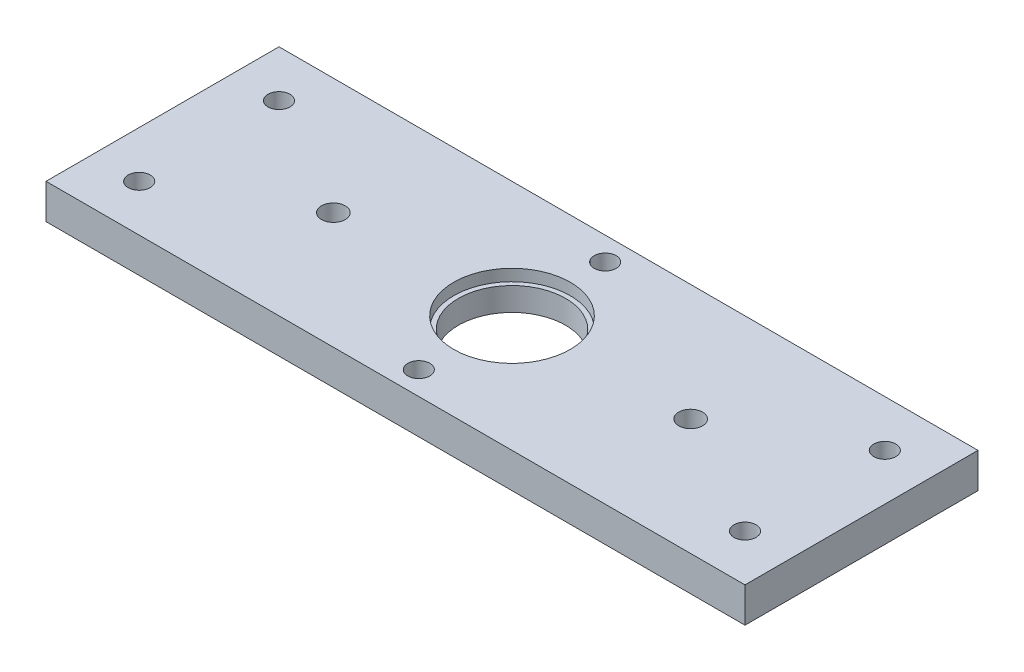
from build123d import *

# Parameters (mm, degrees)
SKETCH1_W                  = 190.5
SKETCH1_H                  = 63.5
BOSS_EXTRUDE1_DEPTH        = 9.525
SKETCH3_R                  = 14.605
CUT_EXTRUDE1_DEPTH         = 101.853114107
F_6_0_6_DIAMETER_HOLE1_D   = 6
F_6_5_6_5_DIAMETER_HOLE3_D = 6.5
SKETCH29_R                 = 15.875
CUT_EXTRUDE5_DEPTH         = 3.175
F_6_0_6_DIAMETER_HOLE3_D   = 6


with BuildPart() as part:
    # Sketch1 → Boss-Extrude1 (new body)
    with BuildSketch(Plane(origin=(0, 0, 0), x_dir=(1, 0, 0), z_dir=(0, 1, 0))):
        Rectangle(SKETCH1_W, SKETCH1_H)
    extrude(amount=BOSS_EXTRUDE1_DEPTH)

    # Sketch3 → Cut-Extrude1 (cut, through all)
    with BuildSketch(Plane(origin=(0, 9.525, 0), x_dir=(1, 0, 0), z_dir=(0, 1, 0))):
        Circle(SKETCH3_R)
    extrude(amount=-CUT_EXTRUDE1_DEPTH, mode=Mode.SUBTRACT)

    # Ø6.0 (6) Diameter Hole1 (through all)
    with Locations(Plane(origin=(0, 0, 0), x_dir=(-1, 0, 0), z_dir=(0, -1, 0))):
        with Locations((0, -25.4), (0, 25.4)):
            Hole(F_6_0_6_DIAMETER_HOLE1_D / 2)

    # Ø6.5 (6.5) Diameter Hole3 (through all)
    with Locations(Plane(origin=(0, 0, 0), x_dir=(-1, 0, 0), z_dir=(0, -1, 0))):
        with Locations((48.683333333, 0), (-48.683333333, 0)):
            Hole(F_6_5_6_5_DIAMETER_HOLE3_D / 2)

    # Sketch29 → Cut-Extrude5 (cut)
    with BuildSketch(Plane(origin=(0, 9.525, 0), x_dir=(1, 0, 0), z_dir=(0, 1, 0))):
        Circle(SKETCH29_R)
    extrude(amount=-CUT_EXTRUDE5_DEPTH, mode=Mode.SUBTRACT)

    # Ø6.0 (6) Diameter Hole3 (through all)
    with Locations(Plane(origin=(0, 9.525, 0), x_dir=(1, 0, 0), z_dir=(0, 1, 0))):
        with Locations((-82.55, 19.05), (-82.55, -19.05), (82.55, -19.05), (82.55, 19.05)):
            Hole(F_6_0_6_DIAMETER_HOLE3_D / 2)


solid = part.part
